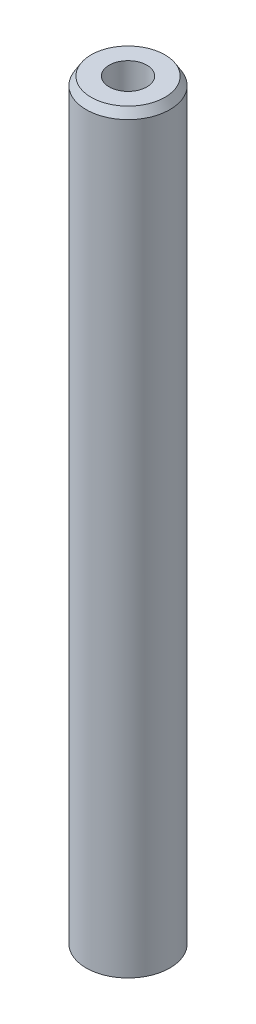
from build123d import *
from OCP.BRepFilletAPI import BRepFilletAPI_MakeChamfer

# Parameters (mm, degrees)
SKETCH1_R           = 20
BOSS_EXTRUDE1_DEPTH = 361.631506853
SKETCH2_R           = 9.014822806
CUT_EXTRUDE1_DEPTH  = 363.735918746
CHAMFER1_SIZE       = 3.915295389
CHAMFER1_SIZE2      = 2.378796374


with BuildPart() as part:
    # Sketch1 → Boss-Extrude1 (new body)
    with BuildSketch(Plane(origin=(0, 0, 0), x_dir=(1, 0, 0), z_dir=(0, 1, 0))):
        Circle(SKETCH1_R)
    extrude(amount=BOSS_EXTRUDE1_DEPTH)

    # Sketch2 → Cut-Extrude1 (cut, through all)
    with BuildSketch(Plane(origin=(0, 0, 0), x_dir=(1, 0, 0), z_dir=(0, 1, 0))):
        Circle(SKETCH2_R)
    extrude(amount=CUT_EXTRUDE1_DEPTH, mode=Mode.SUBTRACT)

    # Chamfer1: one chamfer whose edges measure the first distance from different faces: ONE call of the kernel's chamfer builder (chamfer() names one face for all edges)
    chamfer1_edges_1 = [part.edges().sort_by_distance(p)[0] for p in [
        (-20, 361.631506853, 0),
    ]]
    chamfer1_side_1 = [part.faces().sort_by_distance(p)[0] for p in [
        (-20, 180.815753426, 0),
    ]]
    chamfer1_edges_2 = [part.edges().sort_by_distance(p)[0] for p in [
        (-20, 0, 0),
    ]]
    chamfer1_side_2 = [part.faces().sort_by_distance(p)[0] for p in [
        (-19.434314575, 0, 0),
    ]]
    chamfer1 = BRepFilletAPI_MakeChamfer(part.part.solid().wrapped)
    for e in chamfer1_edges_1:
        chamfer1.Add(CHAMFER1_SIZE, CHAMFER1_SIZE2, e.wrapped, chamfer1_side_1[0].wrapped)  # the first distance lies on this face
    for e in chamfer1_edges_2:
        chamfer1.Add(CHAMFER1_SIZE, CHAMFER1_SIZE2, e.wrapped, chamfer1_side_2[0].wrapped)  # the first distance lies on this face
    add(Compound.cast(chamfer1.Shape()), mode=Mode.REPLACE)


solid = part.part
